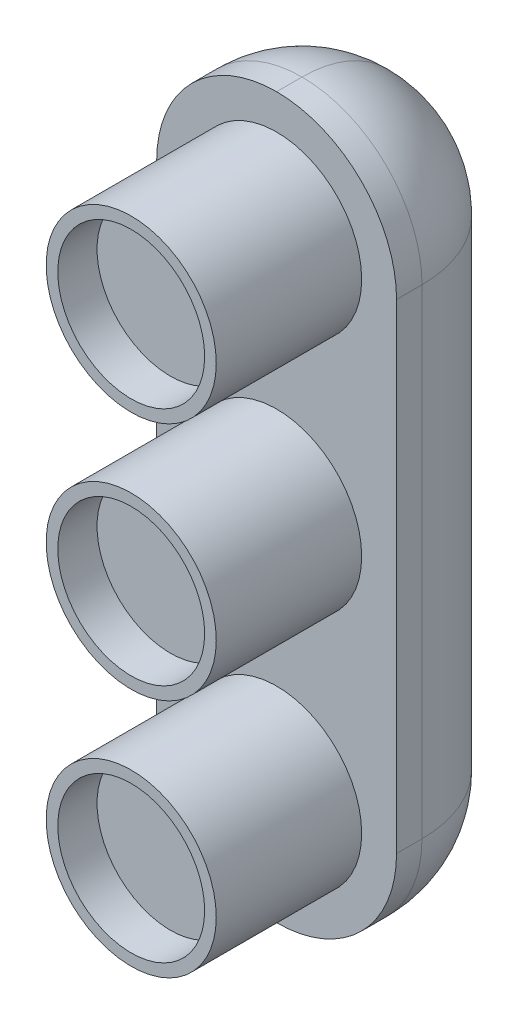
from build123d import *

# Parameters (mm, degrees)
SKETCH1_W           = 16.5
SKETCH1_H           = 49.5
BOSS_EXTRUDE1_DEPTH = 20
SKETCH2_R           = 5.85
SKETCH2_R_2         = 5.05
CUT_EXTRUDE1_DEPTH  = 10
FILLET1_R           = 8.25
SKETCH5_R           = 5.1
BOSS_EXTRUDE2_DEPTH = 7.3


with BuildPart() as part:
    # Sketch1 → Boss-Extrude1 (new body)
    with BuildSketch(Plane.XY):
        with Locations((-57.75, 140.25)):
            Rectangle(SKETCH1_W, SKETCH1_H)
    extrude(amount=BOSS_EXTRUDE1_DEPTH)

    # Sketch2 → Cut-Extrude1 (cut)
    # profile 1 of 8: a face of its own
    with BuildSketch(Plane.XY.offset(20)):
        with BuildLine():
            ThreePointArc((-63.6, 140.25), (-57.75, 146.1), (-51.9, 140.25))
            Line((-51.9, 140.25), (-49.5, 140.25))
            Line((-49.5, 140.25), (-49.5, 165))
            Line((-49.5, 165), (-66, 165))
            Line((-66, 165), (-66, 140.25))
            Line((-66, 140.25), (-63.6, 140.25))
        make_face()
        with Locations((-57.75, 156.75)):
            Circle(SKETCH2_R, mode=Mode.SUBTRACT)
    # profile 2 of 8: a face of its own
    with BuildSketch(Plane.XY.offset(20)):
        with BuildLine():
            Line((-49.5, 140.25), (-51.9, 140.25))
            ThreePointArc((-51.9, 140.25), (-57.75, 134.4), (-63.6, 140.25))
            Line((-63.6, 140.25), (-66, 140.25))
            Line((-66, 140.25), (-66, 115.5))
            Line((-66, 115.5), (-49.5, 115.5))
            Line((-49.5, 115.5), (-49.5, 140.25))
        make_face()
        with Locations((-57.75, 123.75)):
            Circle(SKETCH2_R, mode=Mode.SUBTRACT)
    # profile 3 of 8: a face of its own
    with BuildSketch(Plane.XY.offset(20)):
        with Locations((-57.75, 156.75)):
            Circle(SKETCH2_R_2)
    # profile 4 of 8: a face of its own
    with BuildSketch(Plane.XY.offset(20)):
        with BuildLine():
            ThreePointArc((-62.8, 140.25), (-57.75, 135.2), (-52.7, 140.25))
            Line((-52.7, 140.25), (-62.8, 140.25))
        make_face()
    # profile 5 of 8: a face of its own
    with BuildSketch(Plane.XY.offset(20)):
        with BuildLine():
            Line((-62.8, 140.25), (-52.7, 140.25))
            ThreePointArc((-52.7, 140.25), (-57.75, 145.3), (-62.8, 140.25))
        make_face()
    # profile 6 of 8: a face of its own
    with BuildSketch(Plane.XY.offset(20)):
        with BuildLine():
            ThreePointArc((-62.8, 140.25), (-57.75, 135.2), (-52.7, 140.25))
            Line((-52.7, 140.25), (-62.8, 140.25))
        make_face()
    # profile 7 of 8: a face of its own
    with BuildSketch(Plane.XY.offset(20)):
        with BuildLine():
            Line((-62.8, 140.25), (-52.7, 140.25))
            ThreePointArc((-52.7, 140.25), (-57.75, 145.3), (-62.8, 140.25))
        make_face()
    # profile 8 of 8: a face of its own
    with BuildSketch(Plane.XY.offset(20)):
        with Locations((-57.75, 123.75)):
            Circle(SKETCH2_R_2)
    extrude(amount=-CUT_EXTRUDE1_DEPTH, mode=Mode.SUBTRACT)

    # Fillet1
    fillet1_edges = [part.edges().sort_by_distance(p)[0] for p in [
        (-57.75, 165, 0),
    ]]
    fillet(fillet1_edges, radius=FILLET1_R)
    fillet1_2_edges = [part.edges().sort_by_distance(p)[0] for p in [
        (-49.5, 136.125, 0),
    ]]
    fillet(fillet1_2_edges, radius=FILLET1_R)
    fillet1_3_edges = [part.edges().sort_by_distance(p)[0] for p in [
        (-61.875, 115.5, 0),
    ]]
    fillet(fillet1_3_edges, radius=FILLET1_R)
    fillet1_4_edges = [part.edges().sort_by_distance(p)[0] for p in [
        (-66, 140.25, 0),
    ]]
    fillet(fillet1_4_edges, radius=FILLET1_R - 0.0001)  # a hair under: the kernel refuses the full size

    # Sketch5 → Boss-Extrude2 (add)
    with BuildSketch(Plane.XY.offset(10)):
        with Locations((-57.75, 156.75)):
            Circle(SKETCH5_R)
        with Locations((-57.75, 140.25)):
            Circle(SKETCH5_R)
        with Locations((-57.75, 123.75)):
            Circle(SKETCH5_R)
    extrude(amount=BOSS_EXTRUDE2_DEPTH)


solid = part.part
